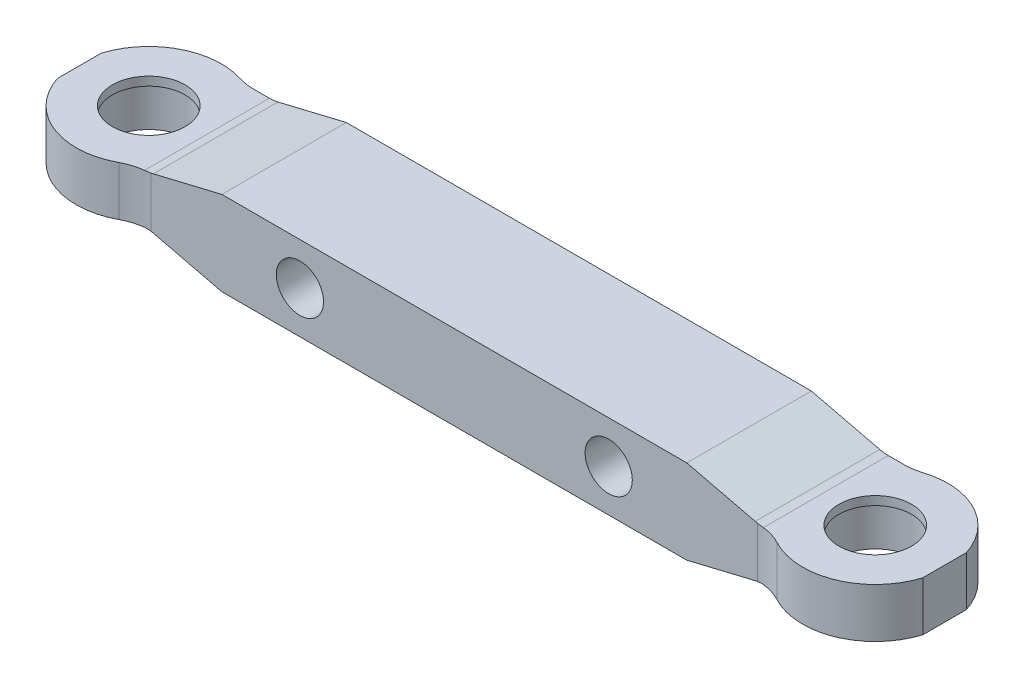
from build123d import *

# Parameters (mm, degrees)
SKETCH2_R               = 7.1247
BOSS_EXTRUDE1_DEPTH     = 14.732
CUT_EXTRUDE1_DEPTH      = 81.803735792
CUT_EXTRUDE1_DEPTH_BACK = 81.803735792
SKETCH3_R               = 2.3622
SKETCH4_R               = 4.1275
CUT_EXTRUDE2_DEPTH      = 8.89
FILLET2_R               = 9.525
FILLET3_R               = 6.35
BOSS_EXTRUDE2_START     = -1.524
SKETCH5_R               = 7.1247
SKETCH5_R_2             = 6.35
BOSS_EXTRUDE2_DEPTH     = 1.524


with BuildPart() as part:
    # Sketch2 → Boss-Extrude1 (new body)
    with BuildSketch(Plane(origin=(0, 0, 0), x_dir=(1, 0, 0), z_dir=(0, 1, 0))):
        with BuildLine():
            Line((-58.522636843, 21.7678), (58.522636843, 21.7678))
            ThreePointArc((58.522636843, 21.7678), (68.813805919, 21.618680435), (75.615027858, 13.8938))
            Line((75.615027858, 13.8938), (75.615027858, 6.2738))
            ThreePointArc((75.615027858, 6.2738), (67.329880989, -2.024957641), (55.779444479, 0))
            Line((55.779444479, 0), (-55.779444479, 0))
            ThreePointArc((-55.779444479, 0), (-67.329880989, -2.024957641), (-75.615027858, 6.2738))
            Line((-75.615027858, 6.2738), (-75.615027858, 13.8938))
            ThreePointArc((-75.615027858, 13.8938), (-68.813805919, 21.618680435), (-58.522636843, 21.7678))
        make_face()
        with Locations((-63.5, 10.0838)):
            Circle(SKETCH2_R, mode=Mode.SUBTRACT)
        with Locations((63.5, 10.0838)):
            Circle(SKETCH2_R, mode=Mode.SUBTRACT)
    extrude(amount=BOSS_EXTRUDE1_DEPTH)

    # Sketch3 → Cut-Extrude1 (cut, two sides: drawn at the far end of the back side and taken through both)
    with BuildSketch(Plane(origin=(0, 0, -21.7678), x_dir=(-1, 0, 0), z_dir=(0, 0, -1)).offset(-CUT_EXTRUDE1_DEPTH_BACK)):
        with Locations((26.9875, 7.366)):
            Circle(SKETCH3_R)
        with Locations((-26.9875, 7.366)):
            Circle(SKETCH3_R)
        Polygon((53.34, 3.048), (78.74, 3.048), (78.74, -5.08), (40.64, -5.08), (40.64, 0), align=None)
        Polygon((40.64, 14.732), (40.64, 19.812), (78.74, 19.812), (78.74, 11.684), (53.34, 11.684), align=None)
        Polygon((-78.74, -5.08), (-78.74, 3.048), (-53.34, 3.048), (-40.64, 0), (-40.64, -5.08), align=None)
        Polygon((-40.64, 14.732), (-40.64, 19.812), (-78.74, 19.812), (-78.74, 11.684), (-53.34, 11.684), align=None)
    extrude(amount=CUT_EXTRUDE1_DEPTH + CUT_EXTRUDE1_DEPTH_BACK, mode=Mode.SUBTRACT)

    # Sketch4 → Cut-Extrude2 (cut)
    with BuildSketch(Plane.XY):
        with Locations((-26.9875, 7.366)):
            Circle(SKETCH4_R)
        with Locations((26.9875, 7.366)):
            Circle(SKETCH4_R)
    extrude(amount=-CUT_EXTRUDE2_DEPTH, mode=Mode.SUBTRACT)

    # Fillet2
    fillet2_edges = [part.edges().sort_by_distance(p)[0] for p in [
        (-58.522636843, 7.366, -21.7678),
        (58.522636843, 7.366, -21.7678),
        (55.779444479, 7.366, 0),
        (-55.779444479, 7.366, 0),
    ]]
    fillet(fillet2_edges, radius=FILLET2_R)

    # Fillet3
    fillet3_edges = [part.edges().sort_by_distance(p)[0] for p in [
        (-53.34, 3.048, -10.881511544),
    ]]
    fillet(fillet3_edges, radius=FILLET3_R)
    fillet3_2_edges = [part.edges().sort_by_distance(p)[0] for p in [
        (-53.34, 11.684, -10.881511544),
    ]]
    fillet(fillet3_2_edges, radius=FILLET3_R)
    fillet3_3_edges = [part.edges().sort_by_distance(p)[0] for p in [
        (53.34, 3.048, -10.881511544),
    ]]
    fillet(fillet3_3_edges, radius=FILLET3_R)
    fillet3_4_edges = [part.edges().sort_by_distance(p)[0] for p in [
        (53.34, 11.684, -10.881511544),
    ]]
    fillet(fillet3_4_edges, radius=FILLET3_R)

    # Sketch5 → Boss-Extrude2 (add)
    # profile 1 of 2: a face of its own
    with BuildSketch(Plane(origin=(0, 11.684, 0), x_dir=(1, 0, 0), z_dir=(0, 1, 0)).offset(BOSS_EXTRUDE2_START)):
        with Locations((63.5, 10.0838)):
            Circle(SKETCH5_R)
        with Locations((63.5, 10.0838)):
            Circle(SKETCH5_R_2, mode=Mode.SUBTRACT)
    # profile 2 of 2: a face of its own
    with BuildSketch(Plane(origin=(0, 11.684, 0), x_dir=(1, 0, 0), z_dir=(0, 1, 0)).offset(BOSS_EXTRUDE2_START)):
        with Locations((-63.5, 10.0838)):
            Circle(SKETCH5_R)
        with Locations((-63.5, 10.0838)):
            Circle(SKETCH5_R_2, mode=Mode.SUBTRACT)
    extrude(amount=BOSS_EXTRUDE2_DEPTH)


solid = part.part
